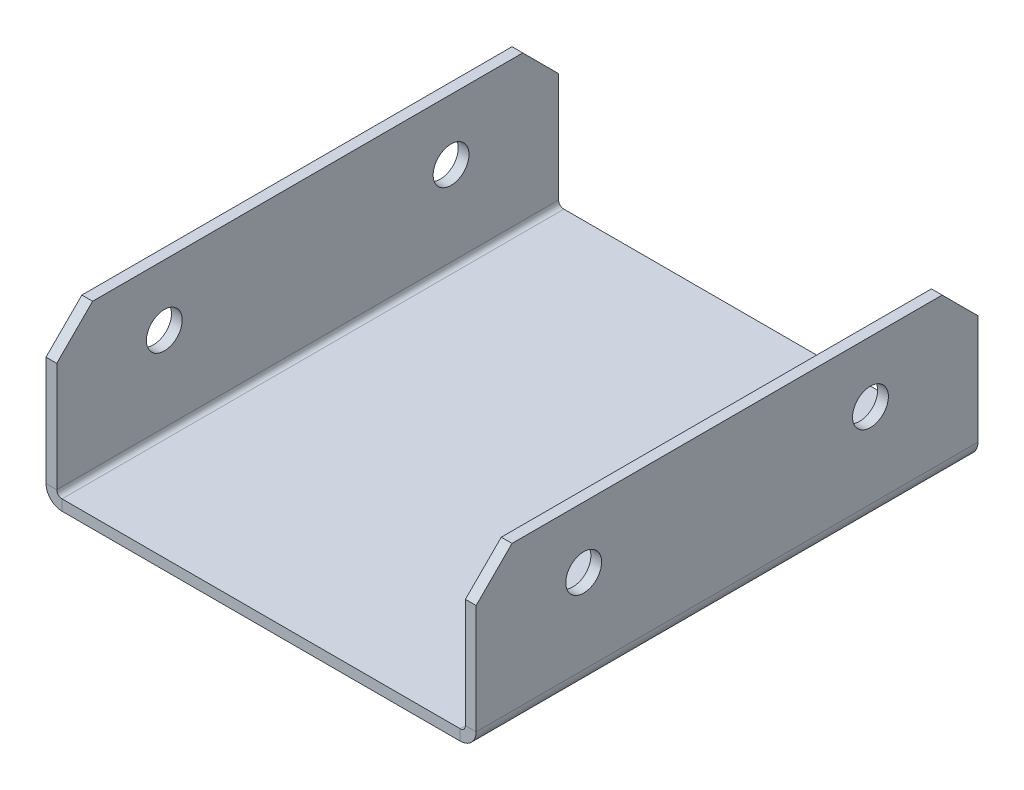
from build123d import *

# Parameters (mm, degrees)
CROQUIS1_W                         = 60
CROQUIS1_H                         = 70
BRIDA_BASE1_DEPTH                  = 1.5
BRIDA_DE_ARISTA1_STRIP_W           = 7.4732
BRIDA_DE_ARISTA1_STRIP_H           = 1.5
BRIDA_DE_ARISTA1_STRIP_CUT_DEPTH   = 70
BRIDA_DE_ARISTA1_STRIP_2_W         = 7.4732
BRIDA_DE_ARISTA1_STRIP_2_H         = 1.5
BRIDA_DE_ARISTA1_STRIP_CUT_2_DEPTH = 70
BRIDA_DE_ARISTA1_DEPTH             = 70
BRIDA_DE_ARISTA1_BEND_DEPTH        = 70
ROMPER_START                       = 36.062445841
ROMPER_ESQUINA1_OUTLINE_W          = 64
ROMPER_ESQUINA1_OUTLINE_H          = 51.062445841
ROMPER_ESQUINA1_DEPTH              = 3.535533905
ROMPER_START_2                     = -13.435028843
ROMPER_ESQUINA1_2_OUTLINE_W        = 64
ROMPER_ESQUINA1_2_OUTLINE_H        = 3.937554159
ROMPER_ESQUINA1_2_DEPTH            = 7.071067812
CROQUIS12_R                        = 2.5
CORTAR_EXTRUIR1_DEPTH              = 73.567210226


# Read off the part's stored shape, not the designer's step: Romper esquina1
# Sheet-metal steps are written as plain solids
with BuildPart() as part:
    # Croquis1 → Brida base1 (new body)
    with BuildSketch(Plane(origin=(0, 0, 0), x_dir=(1, 0, 0), z_dir=(0, 1, 0))):
        Rectangle(CROQUIS1_W, CROQUIS1_H)
    extrude(amount=-BRIDA_BASE1_DEPTH)

    # Brida de arista1 strip (across the edge) → Brida de arista1 strip cut (cut)
    with BuildSketch(Plane(origin=(-30, 0, -35), x_dir=(1, 0, 0), z_dir=(0, 0, 1))):
        with Locations((-1.5, -0.75)):
            Rectangle(BRIDA_DE_ARISTA1_STRIP_W, BRIDA_DE_ARISTA1_STRIP_H)
    extrude(amount=BRIDA_DE_ARISTA1_STRIP_CUT_DEPTH, mode=Mode.SUBTRACT)

    # Brida de arista1 strip 2 (across the edge) → Brida de arista1 strip cut 2 (cut)
    with BuildSketch(Plane(origin=(30, 0, 35), x_dir=(-1, 0, 0), z_dir=(0, 0, -1))):
        with Locations((-1.5, -0.75)):
            Rectangle(BRIDA_DE_ARISTA1_STRIP_2_W, BRIDA_DE_ARISTA1_STRIP_2_H)
    extrude(amount=BRIDA_DE_ARISTA1_STRIP_CUT_2_DEPTH, mode=Mode.SUBTRACT)

    # Brida de arista1 section (across the edge) → Brida de arista1 (add)
    with BuildSketch(Plane(origin=(-30, 0, -35), x_dir=(1, 0, 0), z_dir=(0, 0, 1))):
        with BuildLine():
            Line((0, 0.7366), (0, 21))
            Line((0, 21), (1.5, 21))
            Line((1.5, 21), (1.5, 0.7366))
            ThreePointArc((1.5, 0.7366), (1.715745145, 0.215745145), (2.2366, 0))
            Line((2.2366, 0), (2.2366, -1.5))
            ThreePointArc((2.2366, -1.5), (0.655084973, -0.844915027), (0, 0.7366))
        make_face()
    extrude(amount=BRIDA_DE_ARISTA1_DEPTH)

    # Brida de arista1 section 2 (across the edge) → Brida de arista1 bend (add)
    with BuildSketch(Plane(origin=(30, 0, 35), x_dir=(-1, 0, 0), z_dir=(0, 0, -1))):
        with BuildLine():
            Line((0, 0.7366), (0, 21))
            Line((0, 21), (1.5, 21))
            Line((1.5, 21), (1.5, 0.7366))
            ThreePointArc((1.5, 0.7366), (1.715745145, 0.215745145), (2.2366, 0))
            Line((2.2366, 0), (2.2366, -1.5))
            ThreePointArc((2.2366, -1.5), (0.655084973, -0.844915027), (0, 0.7366))
        make_face()
    extrude(amount=BRIDA_DE_ARISTA1_BEND_DEPTH)

    # Romper esquina1 outline → Romper esquina1 (cut)
    with BuildSketch(Plane(origin=(0, 0, 0), x_dir=(1, 0, 0), z_dir=(0, 0.707106781186547, 0.707106781186548)).offset(ROMPER_START)):
        with Locations((0, 10.53122292)):
            Rectangle(ROMPER_ESQUINA1_OUTLINE_W, ROMPER_ESQUINA1_OUTLINE_H)
    extrude(amount=ROMPER_ESQUINA1_DEPTH, mode=Mode.SUBTRACT)

    # Romper esquina1 2 outline → Romper esquina1 2 (cut)
    with BuildSketch(Plane(origin=(0, 0, 0), x_dir=(1, 0, 0), z_dir=(0, 0.707106781186547, 0.707106781186548)).offset(ROMPER_START_2)):
        with Locations((0, 38.03122292)):
            Rectangle(ROMPER_ESQUINA1_2_OUTLINE_W, ROMPER_ESQUINA1_2_OUTLINE_H)
    extrude(amount=ROMPER_ESQUINA1_2_DEPTH, mode=Mode.SUBTRACT)

    # Croquis12 → Cortar-Extruir1 (cut, through all)
    with BuildSketch(Plane(origin=(30, 0, 0), x_dir=(0, 0, -1), z_dir=(1, 0, 0))):
        with Locations(Location((-20, 12.5, 0), (0, 0, 90))):
            Circle(CROQUIS12_R)
        with Locations(Location((20, 12.5, 0), (0, 0, 90))):
            Circle(CROQUIS12_R)
    extrude(amount=-CORTAR_EXTRUIR1_DEPTH, mode=Mode.SUBTRACT)


solid = part.part
